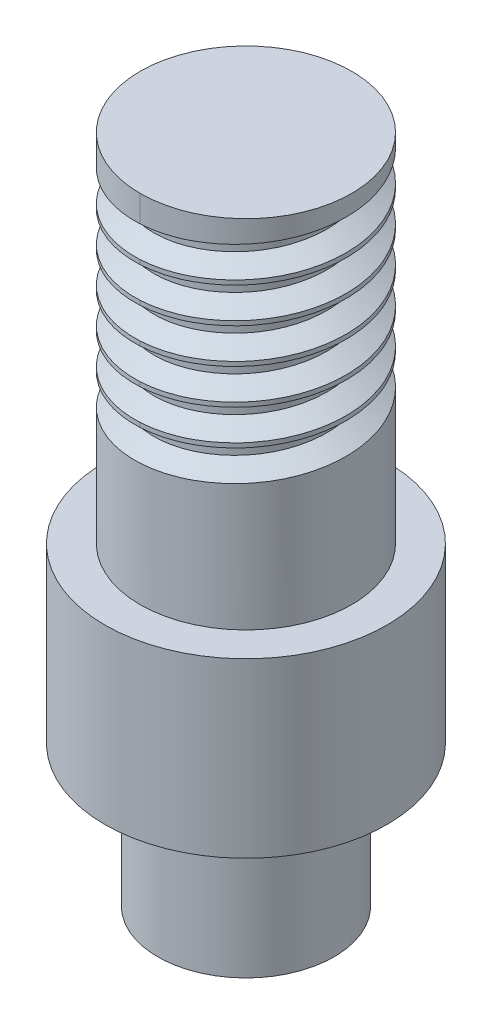
from build123d import *

# Parameters (mm, degrees)
SKETCH1_R           = 4
BOSS_EXTRUDE1_DEPTH = 15
CUT_EXTRUDE1_START  = -10.1
SKETCH2_R           = 4
SKETCH2_R_2         = 3
CUT_EXTRUDE1_DEPTH  = 10.1
THREAD1_PITCH       = 1
SKETCH3_R           = 2.5
BOSS_EXTRUDE2_DEPTH = 4


with BuildPart() as part:
    # Sketch1 → Boss-Extrude1 (new body)
    with BuildSketch(Plane(origin=(0, 0, 0), x_dir=(1, 0, 0), z_dir=(0, 1, 0))):
        with Locations(Location((0, 0, 0), (0, 0, 270))):
            Circle(SKETCH1_R)
    extrude(amount=BOSS_EXTRUDE1_DEPTH)

    # Sketch2 → Cut-Extrude1 (cut)
    with BuildSketch(Plane(origin=(0, 15, 0), x_dir=(1, 0, 0), z_dir=(0, 1, 0)).offset(CUT_EXTRUDE1_START)):
        with Locations(Location((0, 0, 0), (0, 0, 270))):
            Circle(SKETCH2_R)
        with Locations(Location((0, 0, 0), (0, 0, 270))):
            Circle(SKETCH2_R_2, mode=Mode.SUBTRACT)
    extrude(amount=CUT_EXTRUDE1_DEPTH, mode=Mode.SUBTRACT)

    # Thread1: the profile of Thread Profile1 profile screwed along a right-hand helix of 6.1 turns, 8 arcs to a turn; built about Z, then put on its axis
    thread1_z = Axis((0, 0, 0), (0, 0, 1))
    thread1_corners = [(3.0003, 0, -0.000173205), (3.0003, 0, 0.875173202), (2.458734125, 0, 0.562499999), (2.458734125, 0, 0.312499999)]
    with BuildLine(mode=Mode.PRIVATE) as thread1_profile:
        Line(thread1_corners[0], thread1_corners[1])
        Line(thread1_corners[1], thread1_corners[2])
        Line(thread1_corners[2], thread1_corners[3])
        Line(thread1_corners[3], thread1_corners[0])
    thread1_cap = Face(thread1_profile.wire())
    thread1_turn_angles = [0, 22.5, 45, 67.5, 90, 112.5, 135, 157.5, 180, 202.5, 225, 247.5, 270, 292.5, 315, 337.5, 360]
    thread1_turn_weights = [1, 0.9238795325112867, 1, 0.9238795325112867, 1, 0.9238795325112867, 1, 0.9238795325112867, 1, 0.9238795325112867, 1, 0.9238795325112867, 1, 0.9238795325112867, 1, 0.9238795325112867, 1]
    thread1_turn_rails = [Edge.make_bspline([Vector(p[0], p[1], 0).rotate(thread1_z, thread1_turn_angles[k]) / thread1_turn_weights[k] + Vector(0, 0, p[2] + THREAD1_PITCH * thread1_turn_angles[k] / 360) for k in range(17)], [0, 0, 0, 1, 1, 2, 2, 3, 3, 4, 4, 5, 5, 6, 6, 7, 7, 8, 8, 8], 2, thread1_turn_weights) for p in thread1_corners]
    thread1_turn_sides = [Face.make_surface_from_curves(thread1_turn_rails[p[0]], thread1_turn_rails[p[1]]) for p in [(0, 1), (1, 2), (2, 3), (3, 0)]]
    thread1_last_angles = [2160, 2178, 2196]
    thread1_last_weights = [1, 0.9510565162951535, 1]
    thread1_last_rails = [Edge.make_bspline([Vector(p[0], p[1], 0).rotate(thread1_z, thread1_last_angles[k]) / thread1_last_weights[k] + Vector(0, 0, p[2] + THREAD1_PITCH * thread1_last_angles[k] / 360) for k in range(3)], [0, 0, 0, 1, 1, 1], 2, thread1_last_weights) for p in thread1_corners]
    thread1_last_sides = [Face.make_surface_from_curves(thread1_last_rails[p[0]], thread1_last_rails[p[1]]) for p in [(0, 1), (1, 2), (2, 3), (3, 0)]]
    thread1 = Plane(origin=(0, 15, 0), x_dir=(-1, 0, 0), z_dir=(0, -1, 0)) * Solid(Shell([*[p.moved(Location((0, 0, THREAD1_PITCH * i))) for i in range(6) for p in thread1_turn_sides], *thread1_last_sides, thread1_cap, thread1_cap.rotate(thread1_z, 2196).moved(Location((0, 0, THREAD1_PITCH * 2196 / 360)))]))
    add(thread1, mode=Mode.SUBTRACT)

    # Sketch3 → Boss-Extrude2 (add)
    with BuildSketch(Plane.XZ):
        with Locations(Location((0, 0, 0), (0, 0, 270))):
            Circle(SKETCH3_R)
    extrude(amount=BOSS_EXTRUDE2_DEPTH)


solid = part.part
